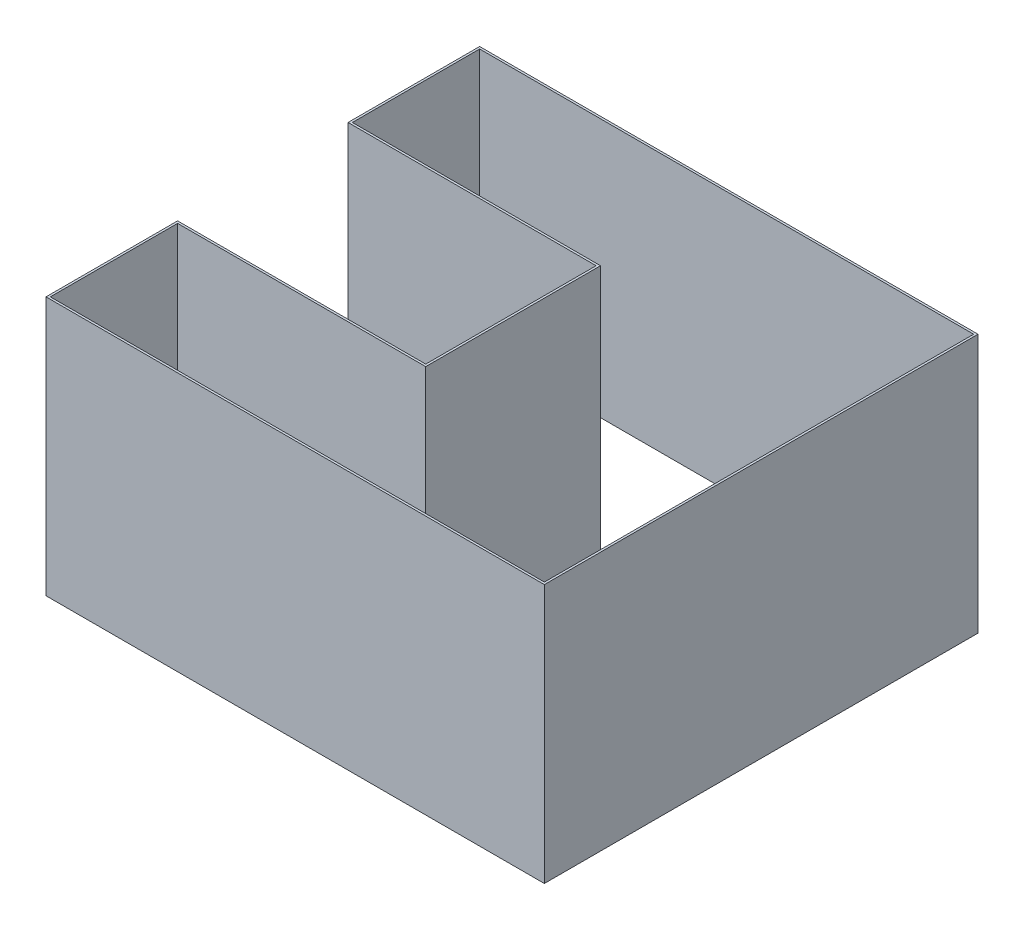
from build123d import *

# Parameters (mm, degrees)
EXTRUDE_THIN1_START = -120
EXTRUDE_THIN1_DEPTH = 120
SCALE1_SCALE        = 0.001


# Read off the part's stored shape, not the designer's step: Extrude-Thin1
with BuildPart() as part:
    # Extrude-Thin1 outline → Extrude-Thin1 (new body)
    with BuildSketch(Plane(origin=(0, 0, 0), x_dir=(1, 0, 0), z_dir=(0, 1, 0)).offset(EXTRUDE_THIN1_START)):
        Polygon((-115, 40), (0, 40), (0, -39), (-115, -39), (-115, -100), (116, -100), (116, 101), (-115, 101), align=None)
        Polygon((1, -40), (1, 41), (-114, 41), (-114, 100), (115, 100), (115, -99), (-114, -99), (-114, -40), align=None, mode=Mode.SUBTRACT)
    extrude(amount=EXTRUDE_THIN1_DEPTH)


with BuildPart() as part_1:
    # Scale1: scaled about (0, 0, 0)
    add(part.part.scale(SCALE1_SCALE))


solid = part_1.part
